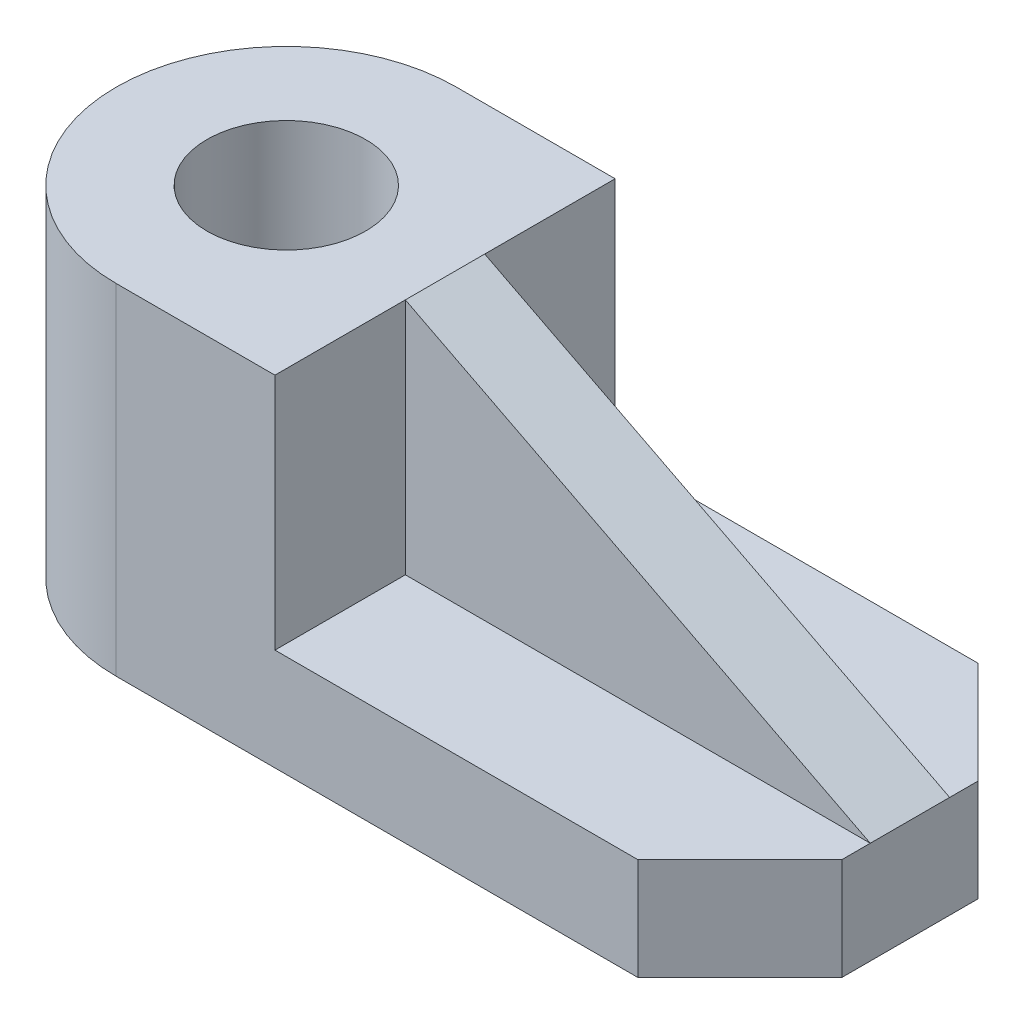
from build123d import *

# Parameters (mm, degrees)
EXTRUDE_1_DEPTH     = 30
FILLET_1_R          = 15
SKETCH_2_R          = 7
CUT_EXTRUDE_1_DEPTH = 82.853527719
EXTRUDE_START       = -11.5
EXTRUDE_3_DEPTH     = 7
CHAMFER_1_SIZE      = 9


with BuildPart() as part:
    # 스케치1 → 보스-돌출1 (new body)
    with BuildSketch(Plane.XY):
        Polygon((0, 0), (-70, 0), (-70, 30), (-41, 30), (-41, 9), (0, 9), align=None)
    extrude(amount=EXTRUDE_1_DEPTH)

    # 필렛1
    fillet_1_edges = [part.edges().sort_by_distance(p)[0] for p in [
        (-70, 15, 0),
        (-70, 15, 30),
    ]]
    fillet(fillet_1_edges, radius=FILLET_1_R - 0.0001)  # a hair under: the kernel refuses the full size

    # 스케치2 → 컷-돌출1 (cut, through all)
    with BuildSketch(Plane(origin=(0, 30, 0), x_dir=(1, 0, 0), z_dir=(0, 1, 0))):
        with Locations(Location((-55, -15, 0), (0, 0, 270))):
            Circle(SKETCH_2_R)
    extrude(amount=-CUT_EXTRUDE_1_DEPTH, mode=Mode.SUBTRACT)

    # 스케치3 → 보스-돌출3 (add)
    with BuildSketch(Plane.XY.offset(30).offset(EXTRUDE_START)):
        Polygon((0, 9), (-41, 30), (-41, 9), align=None)
    extrude(amount=-EXTRUDE_3_DEPTH)

    # 모따기1
    chamfer_1_edges = [part.edges().sort_by_distance(p)[0] for p in [
        (0, 4.5, 30),
        (0, 4.5, 0),
    ]]
    chamfer(chamfer_1_edges, length=CHAMFER_1_SIZE)


solid = part.part
